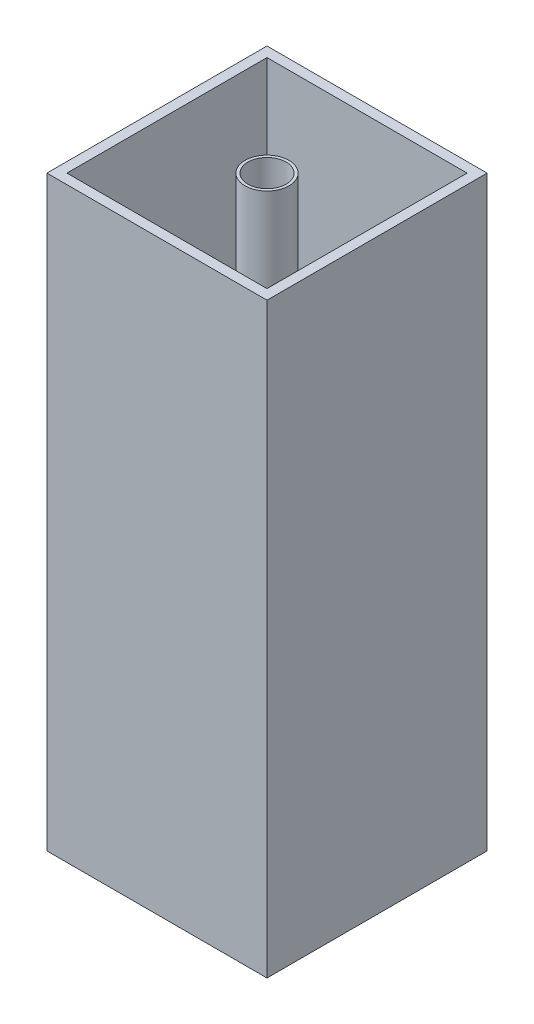
from build123d import *

# Parameters (mm, degrees)
SKETCH1_R           = 15
BOSS_EXTRUDE1_DEPTH = 400
SKETCH2_R           = 13.054210416
CUT_EXTRUDE1_DEPTH  = 400
SKETCH3_W           = 150
SKETCH3_H           = 150
SKETCH3_W_2         = 136.341784578
SKETCH3_H_2         = 136.341784578
BOSS_EXTRUDE2_DEPTH = 400
SKETCH4_W           = 150
SKETCH4_H           = 150
BOSS_EXTRUDE3_DEPTH = 10


with BuildPart() as part:
    # Sketch1 → Boss-Extrude1 (new body)
    with BuildSketch(Plane(origin=(0, 0, 0), x_dir=(1, 0, 0), z_dir=(0, 1, 0))):
        Circle(SKETCH1_R)
    extrude(amount=BOSS_EXTRUDE1_DEPTH)

    # Sketch2 → Cut-Extrude1 (cut)
    with BuildSketch(Plane(origin=(0, 400, 0), x_dir=(1, 0, 0), z_dir=(0, 1, 0))):
        Circle(SKETCH2_R)
    extrude(amount=-CUT_EXTRUDE1_DEPTH, mode=Mode.SUBTRACT)



with BuildPart() as body_2:
    # Sketch3 → Boss-Extrude2 (new body)
    with BuildSketch(Plane(origin=(0, 400, 0), x_dir=(1, 0, 0), z_dir=(0, 1, 0))):
        Rectangle(SKETCH3_W, SKETCH3_H)
        Rectangle(SKETCH3_W_2, SKETCH3_H_2, mode=Mode.SUBTRACT)
    extrude(amount=-BOSS_EXTRUDE2_DEPTH)


with BuildPart() as part_1:
    add(part.part)

    add(body_2.part)  # Boss-Extrude3 merges body 2
    # Sketch4 → Boss-Extrude3 (add)
    with BuildSketch(Plane.XZ):
        Rectangle(SKETCH4_W, SKETCH4_H)
    extrude(amount=-BOSS_EXTRUDE3_DEPTH)


solid = part_1.part
